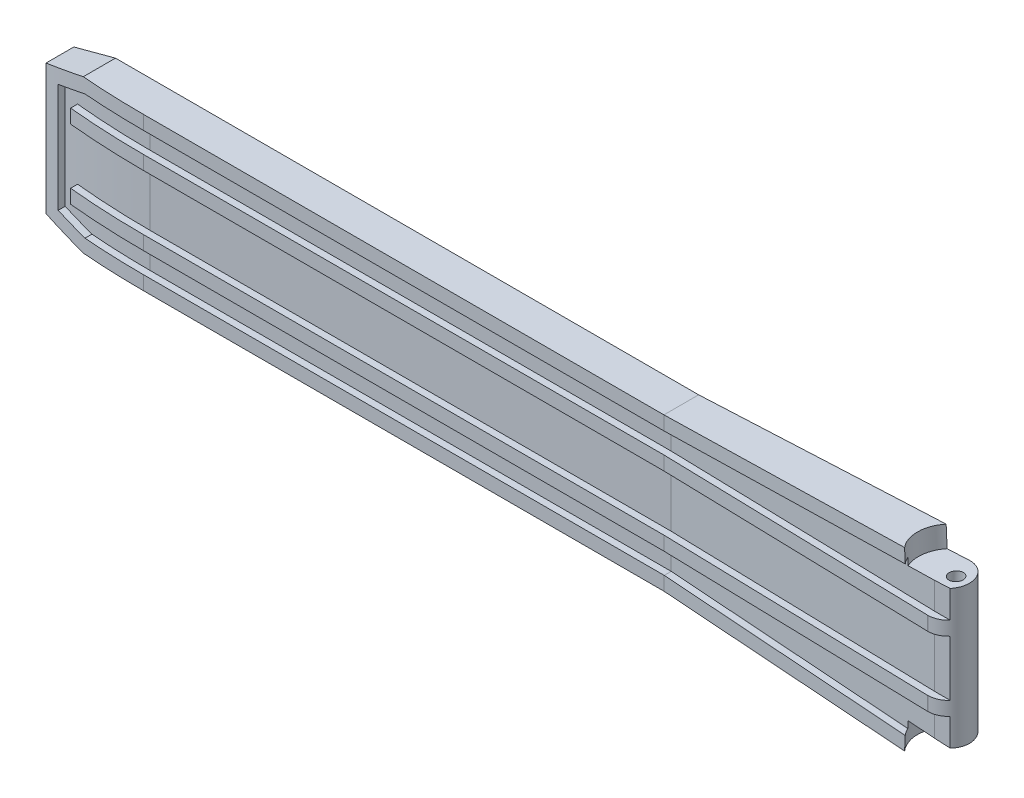
from build123d import *
from OCP.BRepFilletAPI import BRepFilletAPI_MakeChamfer

# Parameters (mm, degrees)
SALIENTE_EXTRUIR1_DEPTH = 6
CHAFL_N1_SIZE           = 6
CHAFL_N1_SIZE2          = 1.607695155
CORTAR_EXTRUIR1_DEPTH   = 3
SALIENTE_EXTRUIR2_DEPTH = 15
CORTAR_EXTRUIR5_START   = -13
CORTAR_EXTRUIR5_DEPTH   = 26
CORTAR_EXTRUIR6_DEPTH   = 92.438482365
CORTAR_EXTRUIR7_START   = -13
CORTAR_EXTRUIR7_DEPTH   = 26
CROQUIS12_R             = 4.5
CORTAR_EXTRUIR8_DEPTH   = 3
CROQUIS13_R             = 1
CORTAR_EXTRUIR9_DEPTH   = 93.238012844


# Read off the part's stored shape, not the designer's step: Cortar-Extruir5, Cortar-Extruir7
with BuildPart() as part:
    # Croquis1 → Saliente-Extruir1 (new body)
    with BuildSketch(Plane.XY):
        Polygon((0, 11), (-90, 11), (-90, -11), (0, -11), (42, -13), (42, 13), align=None)
    extrude(amount=SALIENTE_EXTRUIR1_DEPTH)

    # Chaflán1: one chamfer whose edges measure the first distance from different faces: ONE call of the kernel's chamfer builder (chamfer() names one face for all edges)
    chafl_n1_edges_1 = [part.edges().sort_by_distance(p)[0] for p in [
        (-90, 11, 3),
    ]]
    chafl_n1_side_1 = [part.faces().sort_by_distance(p)[0] for p in [
        (-45, 11, 3),
    ]]
    chafl_n1_edges_2 = [part.edges().sort_by_distance(p)[0] for p in [
        (-90, -11, 3),
    ]]
    chafl_n1_side_2 = [part.faces().sort_by_distance(p)[0] for p in [
        (-45, -11, 3),
    ]]
    chafl_n1 = BRepFilletAPI_MakeChamfer(part.part.solid().wrapped)
    for e in chafl_n1_edges_1:
        chafl_n1.Add(CHAFL_N1_SIZE, CHAFL_N1_SIZE2, e.wrapped, chafl_n1_side_1[0].wrapped)  # the first distance lies on this face
    for e in chafl_n1_edges_2:
        chafl_n1.Add(CHAFL_N1_SIZE, CHAFL_N1_SIZE2, e.wrapped, chafl_n1_side_2[0].wrapped)  # the first distance lies on this face
    add(Compound.cast(chafl_n1.Shape()), mode=Mode.REPLACE)

    # Croquis7 → Cortar-Extruir1 (cut)
    with BuildSketch(Plane.XY.offset(6)):
        Polygon((-88, 7.857650869), (-88, -7.857650869), (-83.736695005, -9), (0.047592083, -9), (42, -10.99773371), (42, -6), (-86, -6), (-86, -4), (42, -4), (42, 4), (-86, 4), (-86, 6), (42, 6), (42, 10.99773371), (0.047592083, 9), (-83.736695005, 9), align=None)
    extrude(amount=-CORTAR_EXTRUIR1_DEPTH, mode=Mode.SUBTRACT)

    # Croquis3 → Saliente-Extruir2 (add, symmetric)
    with BuildSketch(Plane(origin=(-88, 0, 0), x_dir=(0, 0, 1), z_dir=(0, -1, 0))):
        with BuildLine():
            Line((4, -13), (4, -88))
            Line((4, -88), (5, -127))
            Line((5, -127), (5, -130))
            Line((5, -130), (0, -130))
            Line((0, -130), (0, 2))
            Line((0, 2), (3, 2))
            ThreePointArc((3, 2), (3.129320027, 1.000556782), (3.249721603, 0))
            ThreePointArc((3.249721603, 0), (3.812274468, -6.48918366), (4, -13))
        make_face()
    extrude(amount=SALIENTE_EXTRUIR2_DEPTH, both=True)

    # Cortar-Extruir5 outline → Cortar-Extruir5 (cut)
    with BuildSketch(Plane(origin=(0, 0, 0), x_dir=(1, 0, 0), z_dir=(0, 1, 0)).offset(CORTAR_EXTRUIR5_START)):
        with BuildLine():
            Line((-0.012818406, -5), (-75, -5))
            ThreePointArc((-75, -5), (-80.506427226, -4.866936638), (-86, -4.468057179))
            ThreePointArc((-86, -4.468057179), (-88.002027457, -4.256113663), (-90, -4.008849211))
            Line((-90, -4.008849211), (-90, -6))
            Line((-90, -6), (42, -6))
            Line((42, -6), (42, -5.999671431))
            Line((42, -5.999671431), (38.974367399, -5.999671431))
            Line((38.974367399, -5.999671431), (-0.012818406, -5))
        make_face()
    extrude(amount=CORTAR_EXTRUIR5_DEPTH, mode=Mode.SUBTRACT)

    # Croquis9 → Cortar-Extruir6 (cut, through all)
    with BuildSketch(Plane(origin=(0, 0, 0), x_dir=(-1, 0, 0), z_dir=(0, 0, -1))):
        Polygon((-39, 12.857142857), (0, 11), (75, 11), (84, 11), (90, 9.392304845), (90, 15), (-42, 15), (-42, 13), align=None)
        Polygon((-39, -12.857142857), (-42, -13), (-42, -15), (90, -15), (90, -9.392304845), (84, -11), (75, -11), (0, -11), align=None)
    extrude(amount=-CORTAR_EXTRUIR6_DEPTH, mode=Mode.SUBTRACT)

    # Cortar-Extruir7 outline → Cortar-Extruir7 (cut)
    with BuildSketch(Plane(origin=(0, 0, 0), x_dir=(1, 0, 0), z_dir=(0, 1, 0)).offset(CORTAR_EXTRUIR7_START)):
        with BuildLine():
            Line((42, -5.999671431), (42, -2.999890938))
            ThreePointArc((42, -2.999890938), (41.130433899, -5.112013503), (39.025850725, -5.999671431))
            Line((39.025850725, -5.999671431), (42, -5.999671431))
        make_face()
        with BuildLine():
            ThreePointArc((39.000109062, 0), (41.121352287, -0.878647713), (42, -2.999890938))
            Line((42, -2.999890938), (42, 0))
            Line((42, 0), (39.000109062, 0))
        make_face()
    extrude(amount=CORTAR_EXTRUIR7_DEPTH, mode=Mode.SUBTRACT)

    # Croquis12 → Cortar-Extruir8 (cut)
    with BuildSketch(Plane(origin=(-0.522624434, -10.975113122, 0), x_dir=(0.9988681377244376, -0.04756514941544958, 0), z_dir=(-0.04756514941544957, -0.9988681377244375, 0))):
        with Locations((39.567518478, 2.999890938)):
            Circle(CROQUIS12_R)
    cortar_extruir8 = extrude(amount=-CORTAR_EXTRUIR8_DEPTH, mode=Mode.SUBTRACT)

    # Croquis13 → Cortar-Extruir9 (cut, through all)
    with BuildSketch(Plane(origin=(-0.379928986, -7.978508709, 0), x_dir=(0.9988681377244376, -0.0475651494154496, 0), z_dir=(-0.04756514941544959, -0.9988681377244375, 0))):
        with Locations((39.567518478, 2.999890938)):
            Circle(CROQUIS13_R)
    extrude(amount=-CORTAR_EXTRUIR9_DEPTH, mode=Mode.SUBTRACT)

    # Simetría1: Cortar-Extruir8 across plane
    add(cortar_extruir8.mirror(Plane.ZX), mode=Mode.SUBTRACT)


solid = part.part
